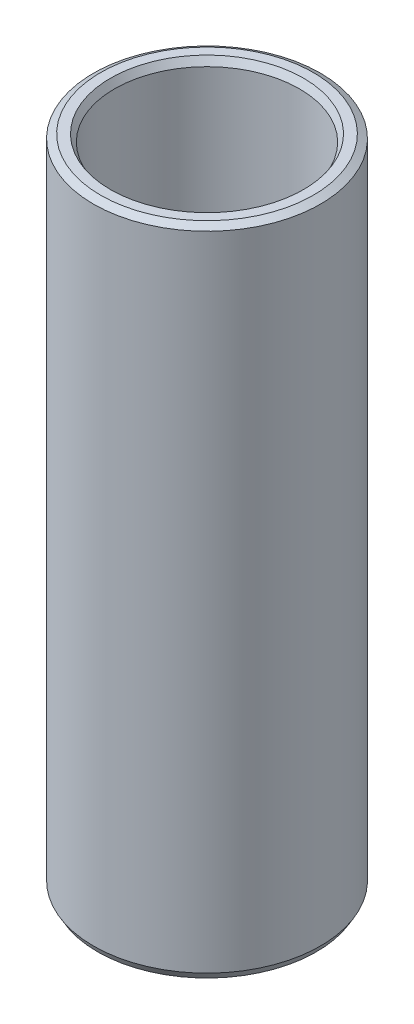
from build123d import *
from OCP.BRepFilletAPI import BRepFilletAPI_MakeChamfer

# Parameters (mm, degrees)
SKETCH1_R           = 32.5
BOSS_EXTRUDE1_DEPTH = 187.21980889
SKETCH2_R           = 26.468711518
CUT_EXTRUDE1_DEPTH  = 193.779036311
CHAMFER1_SIZE       = 1.180716778
CHAMFER1_SIZE2      = 2.045061449


with BuildPart() as part:
    # Sketch1 → Boss-Extrude1 (new body)
    with BuildSketch(Plane(origin=(0, 0, 0), x_dir=(1, 0, 0), z_dir=(0, 1, 0))):
        Circle(SKETCH1_R)
    extrude(amount=BOSS_EXTRUDE1_DEPTH)

    # Sketch2 → Cut-Extrude1 (cut, through all)
    with BuildSketch(Plane(origin=(0, 0, 0), x_dir=(1, 0, 0), z_dir=(0, 1, 0))):
        Circle(SKETCH2_R)
    extrude(amount=CUT_EXTRUDE1_DEPTH, mode=Mode.SUBTRACT)

    # Chamfer1: one chamfer whose edges measure the first distance from different faces: ONE call of the kernel's chamfer builder (chamfer() names one face for all edges)
    chamfer1_edges_1 = [part.edges().sort_by_distance(p)[0] for p in [
        (-26.468711518, 187.21980889, 0),
    ]]
    chamfer1_side_1 = [part.faces().sort_by_distance(p)[0] for p in [
        (-31.580761184, 187.21980889, 0),
    ]]
    chamfer1_edges_2 = [part.edges().sort_by_distance(p)[0] for p in [
        (-26.468711518, 0, 0),
    ]]
    chamfer1_side_2 = [part.faces().sort_by_distance(p)[0] for p in [
        (-26.468711518, 93.609904445, 0),
    ]]
    chamfer1_edges_3 = [part.edges().sort_by_distance(p)[0] for p in [
        (-32.5, 0, 0),
    ]]
    chamfer1_side_3 = [part.faces().sort_by_distance(p)[0] for p in [
        (-31.580761184, 0, 0),
    ]]
    chamfer1_edges_4 = [part.edges().sort_by_distance(p)[0] for p in [
        (-32.5, 187.21980889, 0),
    ]]
    chamfer1_side_4 = [part.faces().sort_by_distance(p)[0] for p in [
        (-32.5, 93.609904445, 0),
    ]]
    chamfer1 = BRepFilletAPI_MakeChamfer(part.part.solid().wrapped)
    for e in chamfer1_edges_1:
        chamfer1.Add(CHAMFER1_SIZE, CHAMFER1_SIZE2, e.wrapped, chamfer1_side_1[0].wrapped)  # the first distance lies on this face
    for e in chamfer1_edges_2:
        chamfer1.Add(CHAMFER1_SIZE, CHAMFER1_SIZE2, e.wrapped, chamfer1_side_2[0].wrapped)  # the first distance lies on this face
    for e in chamfer1_edges_3:
        chamfer1.Add(CHAMFER1_SIZE, CHAMFER1_SIZE2, e.wrapped, chamfer1_side_3[0].wrapped)  # the first distance lies on this face
    for e in chamfer1_edges_4:
        chamfer1.Add(CHAMFER1_SIZE, CHAMFER1_SIZE2, e.wrapped, chamfer1_side_4[0].wrapped)  # the first distance lies on this face
    add(Compound.cast(chamfer1.Shape()), mode=Mode.REPLACE)


solid = part.part
